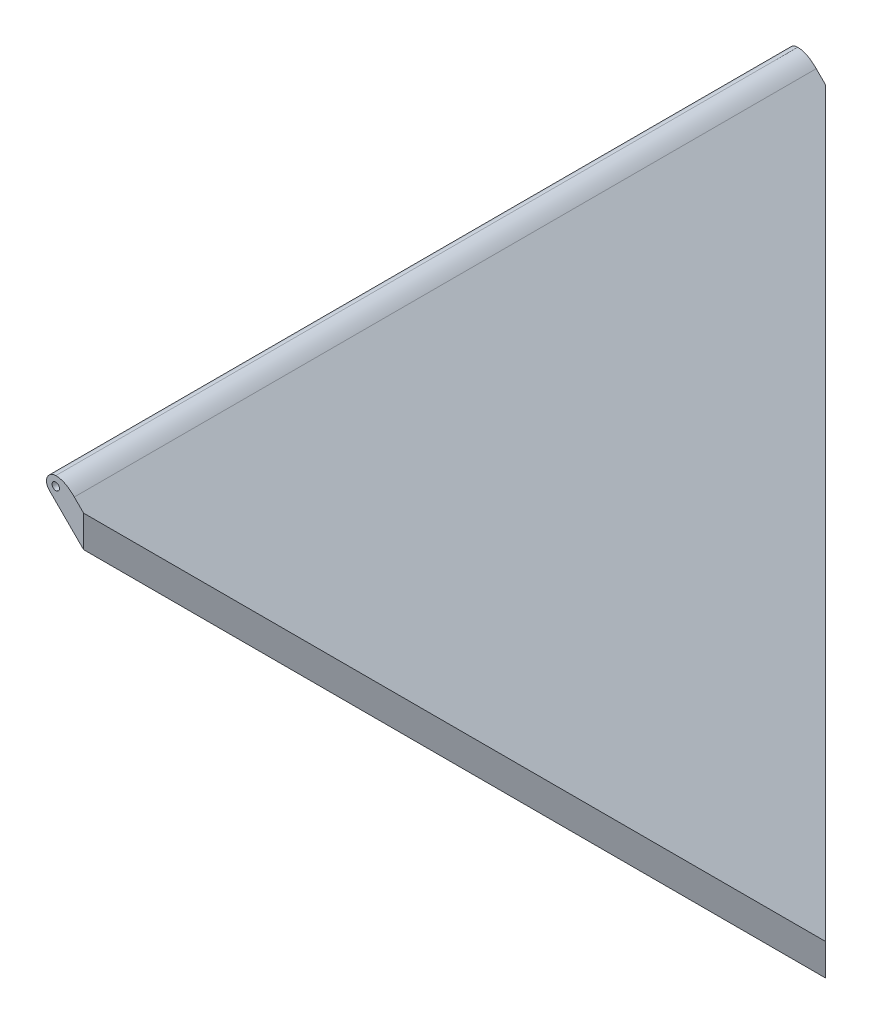
from build123d import *

# Parameters (mm, degrees)
SKETCH2_W               = 500
SKETCH2_H               = 12.5
BOSS_EXTRUDE1_DEPTH     = 500
SKETCH6_R               = 6.25
BOSS_EXTRUDE3_DEPTH     = 500
BOSS_EXTRUDE4_DEPTH     = 500
CUT_EXTRUDE2_DEPTH      = 674.624176563
CUT_EXTRUDE2_DEPTH_BACK = 674.624176563
SKETCH9_R               = 2.5
CUT_EXTRUDE3_DEPTH      = 20
INTERSECT3_START        = -357.972808076
INTERSECT3_DEPTH        = 351.722808076


# Read off the part's stored shape, not the designer's step: Intersect3
with BuildPart() as part:
    # Sketch2 → Boss-Extrude1 (new body)
    with BuildSketch(Plane(origin=(-134.375, 134.375, 0), x_dir=(0, 0, 1), z_dir=(0.7071067811865464, -0.7071067811865488, 0))):
        with Locations((0, 190.034947444)):
            Rectangle(SKETCH2_W, SKETCH2_H)
    extrude(amount=BOSS_EXTRUDE1_DEPTH)

    # Sketch6 → Boss-Extrude3 (add)
    with BuildSketch(Plane.XY.offset(250)):
        with Locations((-268.75, 0)):
            Circle(SKETCH6_R)
    extrude(amount=-BOSS_EXTRUDE3_DEPTH)

    # Sketch7 → Boss-Extrude4 (add)
    with BuildSketch(Plane.XY.offset(250)):
        Polygon((-268.75, 6.25), (-262.5, 6.25), (91.053390593, -347.303390593), (89.222807976, -349.133973211), align=None)
    extrude(amount=-BOSS_EXTRUDE4_DEPTH)

    # Sketch8 → Cut-Extrude2 (cut, two sides: drawn at the far end of the back side and taken through both)
    with BuildSketch(Plane.XY.offset(250).offset(-CUT_EXTRUDE2_DEPTH_BACK)):
        with BuildLine():
            Line((-268.75, 6.25), (-263.442130557, 9.619585215))
            Line((-263.442130557, 9.619585215), (-256.25, 0))
            add(Edge.make_bspline(
                [(-268.75, 6.25), (-263.635709853, 6.25), (-259.544039229, 3.294039229), (-256.25, 0)],
                knots=[0, 0, 0, 0, 1, 1, 1, 1], degree=3))
        make_face()
    extrude(amount=CUT_EXTRUDE2_DEPTH + CUT_EXTRUDE2_DEPTH_BACK, mode=Mode.SUBTRACT)

    # Sketch9 → Cut-Extrude3 (cut)
    with BuildSketch(Plane.XY.offset(250)):
        with Locations((-268.75, 0)):
            Circle(SKETCH9_R)
    cut_extrude3 = extrude(amount=-CUT_EXTRUDE3_DEPTH, mode=Mode.SUBTRACT)

    # Mirror2: Cut-Extrude3 across plane
    add(cut_extrude3.mirror(Plane.XY), mode=Mode.SUBTRACT)

    # Intersect3 outline → Intersect3 (cut)
    with BuildSketch(Plane(origin=(0, 0, 0), x_dir=(1, 0, 0), z_dir=(0, 1, 0)).offset(INTERSECT3_START)):
        Polygon((-250, 250), (0, 0), (-250, -250), (93, -250), (93, 250), align=None)
    extrude(amount=INTERSECT3_DEPTH, mode=Mode.SUBTRACT)


solid = part.part
